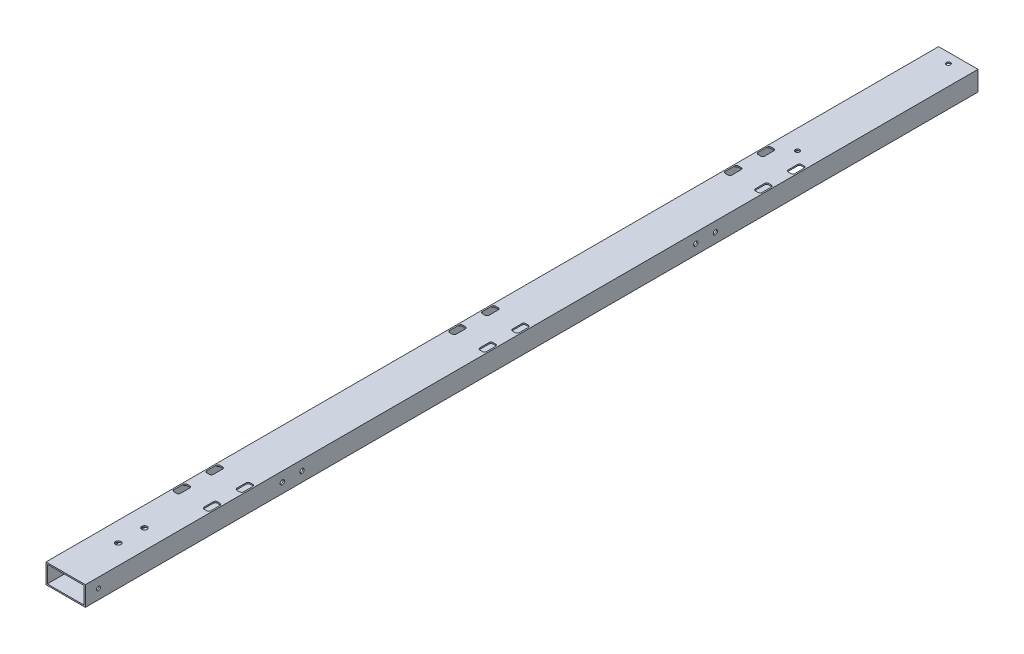
from build123d import *

# Parameters (mm, degrees)
SKETCH_1_W           = 30
SKETCH_1_H           = 15
SKETCH_1_W_2         = 28
SKETCH_1_H_2         = 13
EXTRUDE_1_DEPTH      = 800
SKETCH_4_R           = 1.5
CUT_EXTRUDE_3_DEPTH  = 801.702816281
SKETCH_5_R           = 1.65
CUT_EXTRUDE_4_DEPTH  = 801.702816281
SKETCH_6_W           = 30
SKETCH_6_H           = 15
CUT_EXTRUDE_5_DEPTH  = 300
SKETCH_8_W           = 30
SKETCH_8_H           = 15
SKETCH_8_W_2         = 28
SKETCH_8_H_2         = 13
EXTRUDE_1_2_DEPTH    = 180
SKETCH_9_R           = 2.05
CUT_EXTRUDE_7_DEPTH  = 10
CUT_EXTRUDE_8_DEPTH  = 10
SKETCH_11_R          = 1.6
CUT_EXTRUDE_9_DEPTH  = 801.702816281
CUT_EXTRUDE_10_REACH = 802.703
SKETCH_13_R          = 1.25
CUT_EXTRUDE_11_DEPTH = 801.702816281
CUT_EXTRUDE_START    = -10
SKETCH_14_W          = 5
SKETCH_14_H          = 10
SKETCH_14_R          = 1.25
CUT_EXTRUDE_13_DEPTH = 10
FILLET_2_R           = 1.5


with BuildPart() as part:
    # 草图1 → Extrude 1 (new body)
    with BuildSketch(Plane.XY):
        with Locations((15, -7.5)):
            Rectangle(SKETCH_1_W, SKETCH_1_H)
        with Locations((15, -7.5)):
            Rectangle(SKETCH_1_W_2, SKETCH_1_H_2, mode=Mode.SUBTRACT)
    extrude(amount=EXTRUDE_1_DEPTH)

    # 草图4 → 切除-拉伸3 (cut, through all)
    with BuildSketch(Plane(origin=(30, 0, 0), x_dir=(0, 0, -1), z_dir=(1, 0, 0))):
        with Locations((-790, -7.5)):
            Circle(SKETCH_4_R)
    extrude(amount=-CUT_EXTRUDE_3_DEPTH, mode=Mode.SUBTRACT)

    # 草图5 → 切除-拉伸4 (cut, through all)
    with BuildSketch(Plane(origin=(30, 0, 0), x_dir=(0, 0, -1), z_dir=(1, 0, 0))):
        with Locations((-320, -7.5)):
            Circle(SKETCH_5_R)
        with Locations((-335, -7.5)):
            Circle(SKETCH_5_R)
        with Locations((-635, -7.5)):
            Circle(SKETCH_5_R)
        with Locations((-650, -7.5)):
            Circle(SKETCH_5_R)
    extrude(amount=-CUT_EXTRUDE_4_DEPTH, mode=Mode.SUBTRACT)

    # 草图6 → 切除-拉伸5 (cut)
    with BuildSketch(Plane(origin=(0, 0, 0), x_dir=(-1, 0, 0), z_dir=(0, 0, -1))):
        with Locations((-15, -7.5)):
            Rectangle(SKETCH_6_W, SKETCH_6_H)
    extrude(amount=-CUT_EXTRUDE_5_DEPTH, mode=Mode.SUBTRACT)

    # 草图8 → Extrude 1 2 (add)
    with BuildSketch(Plane(origin=(0, 0, 300), x_dir=(-1, 0, 0), z_dir=(0, 0, -1))):
        with Locations((-15, -7.5)):
            Rectangle(SKETCH_8_W, SKETCH_8_H)
        with Locations((-15, -7.5)):
            Rectangle(SKETCH_8_W_2, SKETCH_8_H_2, mode=Mode.SUBTRACT)
    extrude(amount=EXTRUDE_1_2_DEPTH)

    # 草图9 → 切除-拉伸7 (cut)
    with BuildSketch(Plane(origin=(0, 0, 0), x_dir=(1, 0, 0), z_dir=(0, 1, 0))):
        with Locations((15, -740)):
            Circle(SKETCH_9_R)
        with Locations((15, -760)):
            Circle(SKETCH_9_R)
    extrude(amount=-CUT_EXTRUDE_7_DEPTH, mode=Mode.SUBTRACT)

    # 草图10 → 切除-拉伸8 (cut)
    with BuildSketch(Plane.XZ.offset(15)):
        with BuildLine():
            Line((8, 735), (8, 760))
            ThreePointArc((8, 760), (15, 767), (22, 760))
            Line((22, 760), (22, 735))
            ThreePointArc((22, 735), (15, 728), (8, 735))
        make_face()
    extrude(amount=-CUT_EXTRUDE_8_DEPTH, mode=Mode.SUBTRACT)

    # 草图11 → 切除-拉伸9 (cut, through all)
    with BuildSketch(Plane.XZ.offset(15)):
        with Locations((15, 127.5)):
            Circle(SKETCH_11_R)
        with Locations((15, 242.5)):
            Circle(SKETCH_11_R)
    extrude(amount=-CUT_EXTRUDE_9_DEPTH, mode=Mode.SUBTRACT)

    # 草图12 → 切除-拉伸10 (cut, up to next)
    with BuildSketch(Plane.XZ.offset(15), mode=Mode.PRIVATE) as cut_extrude_10_sk1:
        with BuildLine():
            Line((22, 247), (22, 237))
            ThreePointArc((22, 237), (15, 230), (8, 237))
            Line((8, 237), (8, 247))
            ThreePointArc((8, 247), (15, 254), (22, 247))
        make_face()
    cut_extrude_10_tool1 = extrude(cut_extrude_10_sk1.sketch, amount=-CUT_EXTRUDE_10_REACH, mode=Mode.PRIVATE) & part.part
    add(cut_extrude_10_tool1.solids().sort_by_distance((15, -15, 242))[0], mode=Mode.SUBTRACT)

    # 草图13 → 切除-拉伸11 (cut, through all)
    with BuildSketch(Plane.XZ.offset(15)):
        with Locations((27.5, 700)):
            Circle(SKETCH_13_R)
        with Locations((2.5, 700)):
            Circle(SKETCH_13_R)
        with Locations((2.5, 675)):
            Circle(SKETCH_13_R)
        with Locations((27.5, 675)):
            Circle(SKETCH_13_R)
        with Locations((27.5, 465)):
            Circle(SKETCH_13_R)
        with Locations((27.5, 490)):
            Circle(SKETCH_13_R)
        with Locations((2.5, 490)):
            Circle(SKETCH_13_R)
        with Locations((2.5, 465)):
            Circle(SKETCH_13_R)
        with Locations((27.5, 255)):
            Circle(SKETCH_13_R)
        with Locations((27.5, 280)):
            Circle(SKETCH_13_R)
        with Locations((2.5, 280)):
            Circle(SKETCH_13_R)
        with Locations((2.5, 255)):
            Circle(SKETCH_13_R)
    extrude(amount=-CUT_EXTRUDE_11_DEPTH, mode=Mode.SUBTRACT)

    # 草图14 → 切除-拉伸13 (cut)
    # profile 1 of 12: a face of its own
    with BuildSketch(Plane.XZ.offset(15).offset(CUT_EXTRUDE_START)):
        with Locations((3.5, 700)):
            Rectangle(SKETCH_14_W, SKETCH_14_H)
        with Locations((2.5, 700)):
            Circle(SKETCH_14_R, mode=Mode.SUBTRACT)
    # profile 2 of 12: a face of its own
    with BuildSketch(Plane.XZ.offset(15).offset(CUT_EXTRUDE_START)):
        with Locations((3.5, 675)):
            Rectangle(SKETCH_14_W, SKETCH_14_H)
        with Locations((2.5, 675)):
            Circle(SKETCH_14_R, mode=Mode.SUBTRACT)
    # profile 3 of 12: a face of its own
    with BuildSketch(Plane.XZ.offset(15).offset(CUT_EXTRUDE_START)):
        with Locations((26.5, 700)):
            Rectangle(SKETCH_14_W, SKETCH_14_H)
        with Locations((27.5, 700)):
            Circle(SKETCH_14_R, mode=Mode.SUBTRACT)
    # profile 4 of 12: a face of its own
    with BuildSketch(Plane.XZ.offset(15).offset(CUT_EXTRUDE_START)):
        with Locations((3.5, 490)):
            Rectangle(SKETCH_14_W, SKETCH_14_H)
        with Locations((2.5, 490)):
            Circle(SKETCH_14_R, mode=Mode.SUBTRACT)
    # profile 5 of 12: a face of its own
    with BuildSketch(Plane.XZ.offset(15).offset(CUT_EXTRUDE_START)):
        with Locations((26.5, 675)):
            Rectangle(SKETCH_14_W, SKETCH_14_H)
        with Locations((27.5, 675)):
            Circle(SKETCH_14_R, mode=Mode.SUBTRACT)
    # profile 6 of 12: a face of its own
    with BuildSketch(Plane.XZ.offset(15).offset(CUT_EXTRUDE_START)):
        with Locations((3.5, 465)):
            Rectangle(SKETCH_14_W, SKETCH_14_H)
        with Locations((2.5, 465)):
            Circle(SKETCH_14_R, mode=Mode.SUBTRACT)
    # profile 7 of 12: a face of its own
    with BuildSketch(Plane.XZ.offset(15).offset(CUT_EXTRUDE_START)):
        with Locations((26.5, 490)):
            Rectangle(SKETCH_14_W, SKETCH_14_H)
        with Locations((27.5, 490)):
            Circle(SKETCH_14_R, mode=Mode.SUBTRACT)
    # profile 8 of 12: a face of its own
    with BuildSketch(Plane.XZ.offset(15).offset(CUT_EXTRUDE_START)):
        with Locations((26.5, 465)):
            Rectangle(SKETCH_14_W, SKETCH_14_H)
        with Locations((27.5, 465)):
            Circle(SKETCH_14_R, mode=Mode.SUBTRACT)
    # profile 9 of 12: a face of its own
    with BuildSketch(Plane.XZ.offset(15).offset(CUT_EXTRUDE_START)):
        with Locations((3.5, 280)):
            Rectangle(SKETCH_14_W, SKETCH_14_H)
        with Locations((2.5, 280)):
            Circle(SKETCH_14_R, mode=Mode.SUBTRACT)
    # profile 10 of 12: a face of its own
    with BuildSketch(Plane.XZ.offset(15).offset(CUT_EXTRUDE_START)):
        with Locations((3.5, 255)):
            Rectangle(SKETCH_14_W, SKETCH_14_H)
        with Locations((2.5, 255)):
            Circle(SKETCH_14_R, mode=Mode.SUBTRACT)
    # profile 11 of 12: a face of its own
    with BuildSketch(Plane.XZ.offset(15).offset(CUT_EXTRUDE_START)):
        with Locations((26.5, 280)):
            Rectangle(SKETCH_14_W, SKETCH_14_H)
        with Locations((27.5, 280)):
            Circle(SKETCH_14_R, mode=Mode.SUBTRACT)
    # profile 12 of 12: a face of its own
    with BuildSketch(Plane.XZ.offset(15).offset(CUT_EXTRUDE_START)):
        with Locations((26.5, 255)):
            Rectangle(SKETCH_14_W, SKETCH_14_H)
        with Locations((27.5, 255)):
            Circle(SKETCH_14_R, mode=Mode.SUBTRACT)
    extrude(amount=-CUT_EXTRUDE_13_DEPTH, mode=Mode.SUBTRACT)

    # 圆角2
    fillet_2_edges = [part.edges().sort_by_distance(p)[0] for p in [
        (6, -0.5, 470),
        (1, -0.5, 470),
        (1, -0.5, 460),
        (6, -0.5, 460),
        (24, -0.5, 670),
        (29, -0.5, 670),
        (29, -0.5, 680),
        (24, -0.5, 680),
        (6, -0.5, 260),
        (1, -0.5, 260),
        (1, -0.5, 250),
        (6, -0.5, 250),
        (6, -0.5, 285),
        (1, -0.5, 275),
        (6, -0.5, 275),
        (6, -0.5, 680),
        (1, -0.5, 680),
        (1, -0.5, 670),
        (6, -0.5, 670),
        (24, -0.5, 250),
        (29, -0.5, 250),
        (29, -0.5, 260),
        (24, -0.5, 260),
        (24, -0.5, 695),
        (29, -0.5, 695),
        (29, -0.5, 705),
        (24, -0.5, 705),
        (6, -0.5, 705),
        (1, -0.5, 705),
        (1, -0.5, 695),
        (6, -0.5, 695),
        (6, -0.5, 495),
        (1, -0.5, 495),
        (1, -0.5, 485),
        (6, -0.5, 485),
        (24, -0.5, 275),
        (29, -0.5, 275),
        (29, -0.5, 285),
        (24, -0.5, 285),
        (24, -0.5, 460),
        (29, -0.5, 460),
        (29, -0.5, 470),
        (24, -0.5, 470),
        (24, -0.5, 485),
        (29, -0.5, 485),
        (29, -0.5, 495),
        (24, -0.5, 495),
        (1, -0.5, 285),
    ]]
    fillet(fillet_2_edges, radius=FILLET_2_R)


solid = part.part
